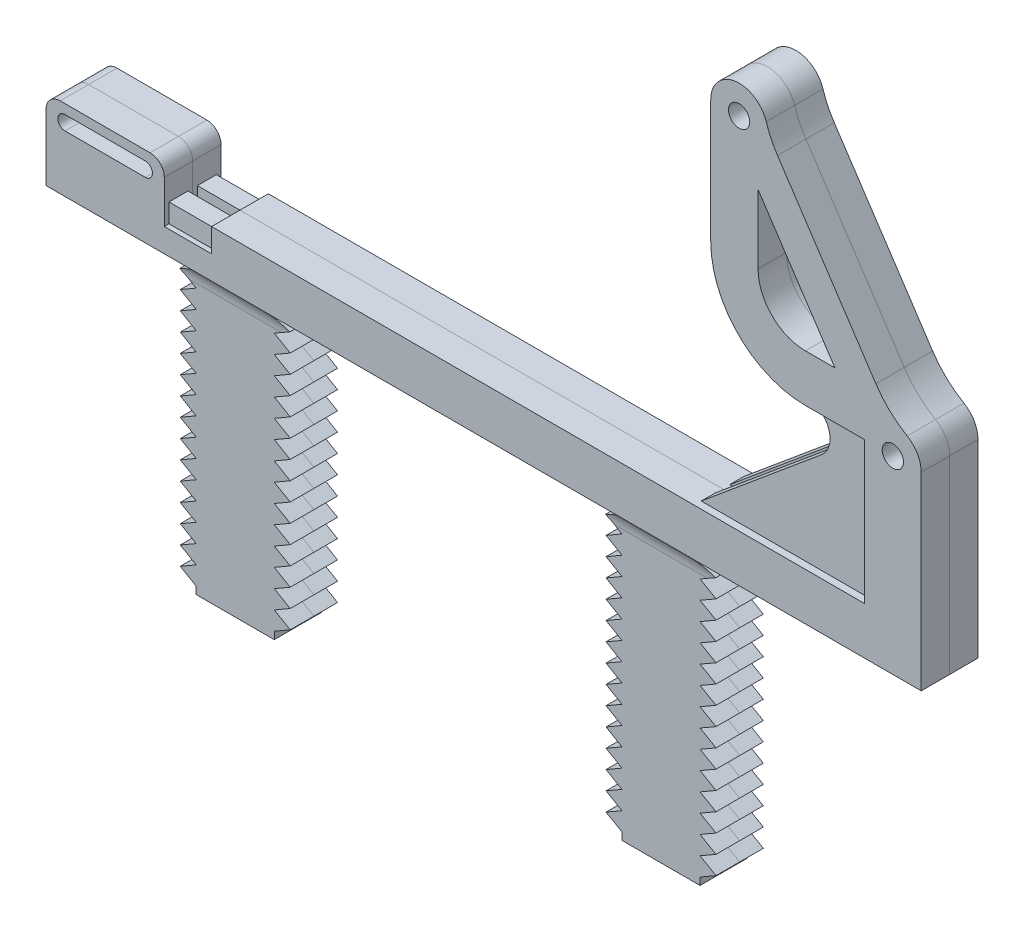
from build123d import *

# Parameters (mm, degrees)
SKETCH1_R           = 2.25
BOSS_EXTRUDE1_DEPTH = 6
BOSS_EXTRUDE2_DEPTH = 6
FILLET1_R           = 3
BOSS_EXTRUDE3_START = -4.5
BOSS_EXTRUDE3_DEPTH = 3
CUT_EXTRUDE1_DEPTH  = 10
FILLET2_R           = 20
FILLET3_R           = 5
FILLET4_R           = 20
FILLET5_R           = 10
BOSS_EXTRUDE5_DEPTH = 5
LPATTERN1_COUNT     = 2
LPATTERN1_PITCH     = 90
FILLET6_R           = 5


with BuildPart() as part:
    # Sketch1 → Boss-Extrude1 (new body)
    with BuildSketch(Plane.XY):
        with BuildLine():
            Line((-6, 0), (-6, -40))
            Line((-6, -40), (6, -40))
            Line((6, -40), (6, 0))
            ThreePointArc((6, 0), (4.242640687, 4.242640687), (0, 6))
            Line((0, 6), (-26.49, 46))
            ThreePointArc((-26.49, 46), (-32.49, 52), (-38.49, 46))
            Line((-38.49, 46), (-38.49, 0))
            Line((-38.49, 0), (-6, 0))
        make_face()
        Circle(SKETCH1_R, mode=Mode.SUBTRACT)
        with Locations((-32.49, 46)):
            Circle(SKETCH1_R, mode=Mode.SUBTRACT)
        Polygon((-28.49, 34.531145288), (-12.244249033, 10), (-28.49, 10), align=None, mode=Mode.SUBTRACT)
    extrude(amount=BOSS_EXTRUDE1_DEPTH)

    # Sketch2 → Boss-Extrude2 (add)
    with BuildSketch(Plane.XY):
        Polygon((6, -40), (-179, -40), (-179, -30), (-179, -23), (-154, -23), (-154, -30), (6, -30), align=None)
        with BuildLine():
            Line((-175, -25), (-158, -25))
            ThreePointArc((-158, -25), (-156.5, -26.5), (-158, -28))
            Line((-158, -28), (-175, -28))
            ThreePointArc((-175, -28), (-176.5, -26.5), (-175, -25))
        make_face(mode=Mode.SUBTRACT)
    extrude(amount=BOSS_EXTRUDE2_DEPTH)

    # Fillet1
    fillet1_edges = [part.edges().sort_by_distance(p)[0] for p in [
        (-154, -23, 3),
        (-179, -23, 3),
    ]]
    fillet(fillet1_edges, radius=FILLET1_R)

    # Sketch3 → Boss-Extrude3 (add)
    with BuildSketch(Plane.XY.offset(6).offset(BOSS_EXTRUDE3_START)):
        Polygon((-6, 0), (-42, -30), (-6, -30), align=None)
    extrude(amount=BOSS_EXTRUDE3_DEPTH)

    # Sketch4 → Cut-Extrude1 (cut)
    with BuildSketch(Plane(origin=(-154, 0, 0), x_dir=(0, 0, -1), z_dir=(1, 0, 0))):
        Polygon((-6, -30), (0, -30), (0, -35), (0, -40), (-1, -40), (-1, -34), (-1, -31), (-5, -31), (-5, -34), (-5, -35), (-6, -35), align=None)
    extrude(amount=CUT_EXTRUDE1_DEPTH, mode=Mode.SUBTRACT)

    # Fillet2
    fillet2_edges = [part.edges().sort_by_distance(p)[0] for p in [
        (-38.49, 0, 3),
    ]]
    fillet(fillet2_edges, radius=FILLET2_R)

    # Fillet3
    # the kernel refuses this fillet: 5 mm, written as the material it adds along each edge
    with BuildSketch(Plane(origin=(-6, 0, 1.5), x_dir=(-0.9999981113094557, 0.0019435476638204458, 0), z_dir=(0, 0, 1))) as fillet3_piece_1:
        with BuildLine():
            CenterArc((13.76117003, 4.993921829), FILLET3_R, 129.916928241, 137.257651262)
            Line((10.552788704, 8.828799828), (10.231950571, 9.212287628))
            Line((10.231950571, 9.212287628), (-0.320838133, 0.3834878))
            Line((-0.320838133, 0.3834878), (0.000971774, -0.499999056))
            ThreePointArc((0.000971774, -0.499999056), (12.490948184, -0.475724145), (13.490059043, -0.499392183))
            Line((13.490059043, -0.499392183), (13.514705497, 0))
        make_face()
    extrude(amount=3)

    # Fillet4
    fillet4_edges = [part.edges().sort_by_distance(p)[0] for p in [
        (-26.49, 46, 3),
        (0, 6, 3),
    ]]
    fillet(fillet4_edges, radius=FILLET4_R)

    # Fillet5
    fillet5_edges = [part.edges().sort_by_distance(p)[0] for p in [
        (-28.49, 10, 3),
    ]]
    fillet(fillet5_edges, radius=FILLET5_R)

    # Sketch5 → Boss-Extrude5 (add)
    with BuildSketch(Plane.XY):
        Polygon((-58.25, -40), (-61.625, -41.948557159), (-58.25, -43.897114317), (-61.625, -45.845671476), (-58.25, -47.794228634), (-61.625, -49.742785793), (-58.25, -51.691342951), (-61.625, -53.63990011), (-58.25, -55.588457268), (-61.625, -57.537014427), (-58.25, -59.485571585), (-61.625, -61.434128744), (-58.25, -63.382685902), (-61.625, -65.331243061), (-58.25, -67.279800219), (-61.625, -69.228357378), (-58.25, -71.176914536), (-61.625, -73.125471695), (-58.25, -75.074028853), (-61.625, -77.022586012), (-58.25, -78.97114317), (-61.625, -80.919700329), (-58.25, -82.868257487), (-61.625, -84.816814646), (-58.25, -86.765371804), (-61.625, -88.713928963), (-58.25, -90.662486121), (-61.625, -92.61104328), (-58.25, -94.559600438), (-61.625, -96.508157597), (-58.25, -98.456714755), (-58.25, -100), (-41.75, -100), (-41.75, -98.456714755), (-38.375, -96.508157597), (-41.75, -94.559600438), (-38.375, -92.61104328), (-41.75, -90.662486121), (-38.375, -88.713928963), (-41.75, -86.765371804), (-38.375, -84.816814646), (-41.75, -82.868257487), (-38.375, -80.919700329), (-41.75, -78.97114317), (-38.375, -77.022586012), (-41.75, -75.074028853), (-38.375, -73.125471695), (-41.75, -71.176914536), (-38.375, -69.228357378), (-41.75, -67.279800219), (-38.375, -65.331243061), (-41.75, -63.382685902), (-38.375, -61.434128744), (-41.75, -59.485571585), (-38.375, -57.537014427), (-41.75, -55.588457268), (-38.375, -53.63990011), (-41.75, -51.691342951), (-38.375, -49.742785793), (-41.75, -47.794228634), (-38.375, -45.845671476), (-41.75, -43.897114317), (-38.375, -41.948557159), (-41.75, -40), align=None)
    boss_extrude5 = extrude(amount=BOSS_EXTRUDE5_DEPTH)

    # LPattern1: Boss-Extrude5 ×2
    with Locations(*[(-i * LPATTERN1_PITCH, 0, 0) for i in range(1, LPATTERN1_COUNT)]):
        add(boss_extrude5)

    # Fillet6
    # the kernel refuses this fillet: 5 mm, written as the material it adds along each edge
    with BuildSketch(Plane(origin=(-34.25, -40, 5), x_dir=(0, 0, 1), z_dir=(-1, 0, 0))) as fillet6_piece_1_section:
        with BuildLine():
            CenterArc((5, -3), FILLET6_R, 143.130102354, 36.869897646)
            Line((0, -3), (-0.1, -3))
            Line((-0.1, -3), (-0.1, 0))
            Line((-0.1, 0), (0, 0.1))
            ThreePointArc((0, 0.1), (0.5, 0.1), (0.92, 0.06))
            Line((0.92, 0.06), (1, 0))
        make_face()
    fillet6_piece_1 = extrude(amount=31.5, mode=Mode.PRIVATE)
    fillet6_piece_1 = split(fillet6_piece_1, bisect_by=Plane(origin=(-52.46109118, -36.657771935, 5.210901553), z_dir=(0.4999999999999993, -0.8660254037844392, 0)), keep=Keep.TOP, mode=Mode.PRIVATE)
    fillet6_piece_1 = split(fillet6_piece_1, bisect_by=Plane(origin=(-47.53890882, -36.657771935, 5.210901553), z_dir=(-0.5000000000000001, -0.8660254037844387, 0)), keep=Keep.TOP, mode=Mode.PRIVATE)
    fillet6_piece_1 = split(fillet6_piece_1, bisect_by=Plane(origin=(-53.35140882, -46.725317253, 5.210901553), z_dir=(0.5000000000000007, 0.8660254037844384, 0)), keep=Keep.TOP, mode=Mode.PRIVATE)
    fillet6_piece_1 = split(fillet6_piece_1, bisect_by=Plane(origin=(-46.64859118, -46.725317253, 5.210901553), z_dir=(-0.5000000000000022, 0.8660254037844374, 0)), keep=Keep.TOP, mode=Mode.PRIVATE)
    add(fillet6_piece_1)
    with BuildSketch(Plane(origin=(-124.25, -40, 5), x_dir=(0, 0, 1), z_dir=(-1, 0, 0))) as fillet6_piece_2_section:
        with BuildLine():
            CenterArc((5, -3), FILLET6_R, 143.130102354, 36.869897646)
            Line((0, -3), (-0.1, -3))
            Line((-0.1, -3), (-0.1, 0))
            Line((-0.1, 0), (0, 0.1))
            ThreePointArc((0, 0.1), (0.5, 0.1), (0.92, 0.06))
            Line((0.92, 0.06), (1, 0))
        make_face()
    fillet6_piece_2 = extrude(amount=31.5, mode=Mode.PRIVATE)
    fillet6_piece_2 = split(fillet6_piece_2, bisect_by=Plane(origin=(-142.46109118, -36.657771935, 5.210901553), z_dir=(0.4999999999999993, -0.8660254037844392, 0)), keep=Keep.TOP, mode=Mode.PRIVATE)
    fillet6_piece_2 = split(fillet6_piece_2, bisect_by=Plane(origin=(-137.53890882, -36.657771935, 5.210901553), z_dir=(-0.5000000000000001, -0.8660254037844387, 0)), keep=Keep.TOP, mode=Mode.PRIVATE)
    fillet6_piece_2 = split(fillet6_piece_2, bisect_by=Plane(origin=(-143.35140882, -46.725317253, 5.210901553), z_dir=(0.5000000000000007, 0.8660254037844384, 0)), keep=Keep.TOP, mode=Mode.PRIVATE)
    fillet6_piece_2 = split(fillet6_piece_2, bisect_by=Plane(origin=(-136.64859118, -46.725317253, 5.210901553), z_dir=(-0.5000000000000022, 0.8660254037844374, 0)), keep=Keep.TOP, mode=Mode.PRIVATE)
    add(fillet6_piece_2)


with BuildPart() as body_2:
    # Mirror1: mirrored copy
    add(part.part.mirror(Plane.XY))


solid = Compound([part.part, body_2.part])
